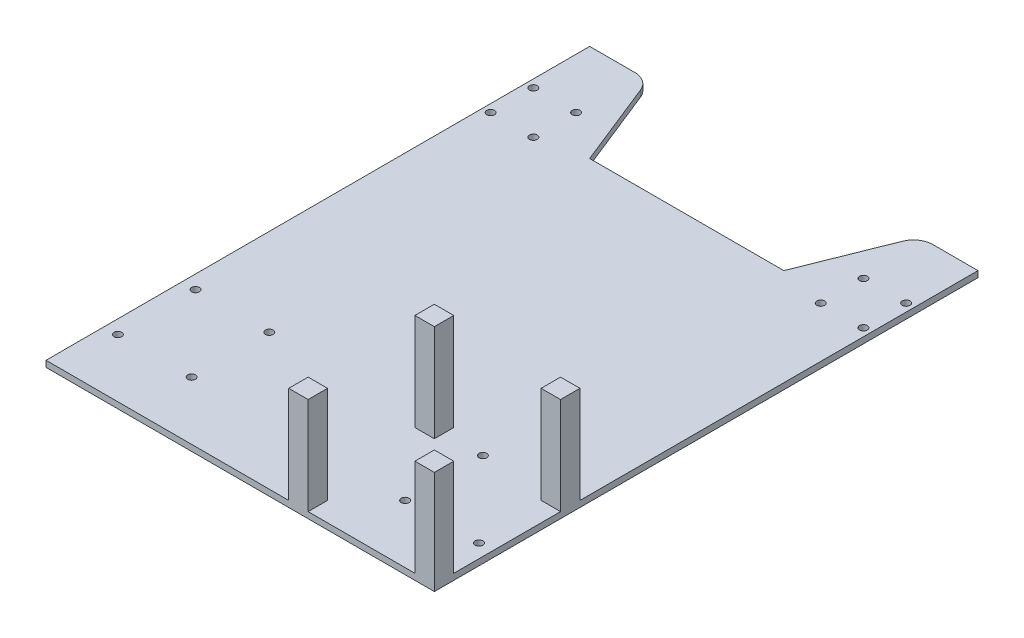
from build123d import *

# Parameters (mm, degrees)
SKETCH3_W           = 200
SKETCH3_H           = 280
BOSS_EXTRUDE1_DEPTH = 3.175
SKETCH4_W           = 10
SKETCH4_H           = 10
BOSS_EXTRUDE2_DEPTH = 50
SKETCH7_R           = 2
SKETCH7_R_2         = 2.000000006
SKETCH7_R_3         = 1.999999994
CUT_EXTRUDE2_DEPTH  = 10
CUT_EXTRUDE4_DEPTH  = 10
FILLET1_R           = 10


with BuildPart() as part:
    # Sketch3 → Boss-Extrude1 (new body)
    with BuildSketch(Plane(origin=(0, 0, 0), x_dir=(1, 0, 0), z_dir=(0, 1, 0))):
        Rectangle(SKETCH3_W, SKETCH3_H)
    extrude(amount=BOSS_EXTRUDE1_DEPTH)

    # Sketch4 → Boss-Extrude2 (add)
    with BuildSketch(Plane(origin=(0, 3.175, 0), x_dir=(1, 0, 0), z_dir=(0, 1, 0))):
        with Locations((95, -135)):
            Rectangle(SKETCH4_W, SKETCH4_H)
        with Locations((95, -70)):
            Rectangle(SKETCH4_W, SKETCH4_H)
        with Locations((30, -135)):
            Rectangle(SKETCH4_W, SKETCH4_H)
        with Locations((30, -70)):
            Rectangle(SKETCH4_W, SKETCH4_H)
    extrude(amount=BOSS_EXTRUDE2_DEPTH)

    # Sketch7 → Cut-Extrude2 (cut)
    with BuildSketch(Plane.XZ):
        with Locations((-93, 70)):
            Circle(SKETCH7_R)
        with Locations((-93, 110)):
            Circle(SKETCH7_R)
        with Locations((-55, 110)):
            Circle(SKETCH7_R_2)
        with Locations((-55, 70)):
            Circle(SKETCH7_R)
        with Locations((55, 110)):
            Circle(SKETCH7_R_3)
        with Locations((93, 110)):
            Circle(SKETCH7_R)
        with Locations((93, 70)):
            Circle(SKETCH7_R)
        with Locations((55, 70)):
            Circle(SKETCH7_R)
        with Locations((96, -107)):
            Circle(SKETCH7_R)
        with Locations((74, -85)):
            Circle(SKETCH7_R)
        with Locations((96, -85)):
            Circle(SKETCH7_R)
        with Locations((74, -107)):
            Circle(SKETCH7_R)
        with Locations((-74, -107)):
            Circle(SKETCH7_R)
        with Locations((-96, -107)):
            Circle(SKETCH7_R)
        with Locations((-96, -85)):
            Circle(SKETCH7_R)
        with Locations((-74, -85)):
            Circle(SKETCH7_R)
    extrude(amount=-CUT_EXTRUDE2_DEPTH, mode=Mode.SUBTRACT)

    # Sketch9 → Cut-Extrude4 (cut)
    with BuildSketch(Plane(origin=(0, 3.175, 0), x_dir=(1, 0, 0), z_dir=(0, 1, 0))):
        Polygon((50, 140), (-50, 140), (-70, 140), (-50, 90), (50, 90), (70, 140), align=None)
    extrude(amount=-CUT_EXTRUDE4_DEPTH, mode=Mode.SUBTRACT)

    # Fillet1
    fillet1_edges = [part.edges().sort_by_distance(p)[0] for p in [
        (-70, 1.5875, -140),
        (70, 1.5875, -140),
    ]]
    fillet(fillet1_edges, radius=FILLET1_R)


solid = part.part
